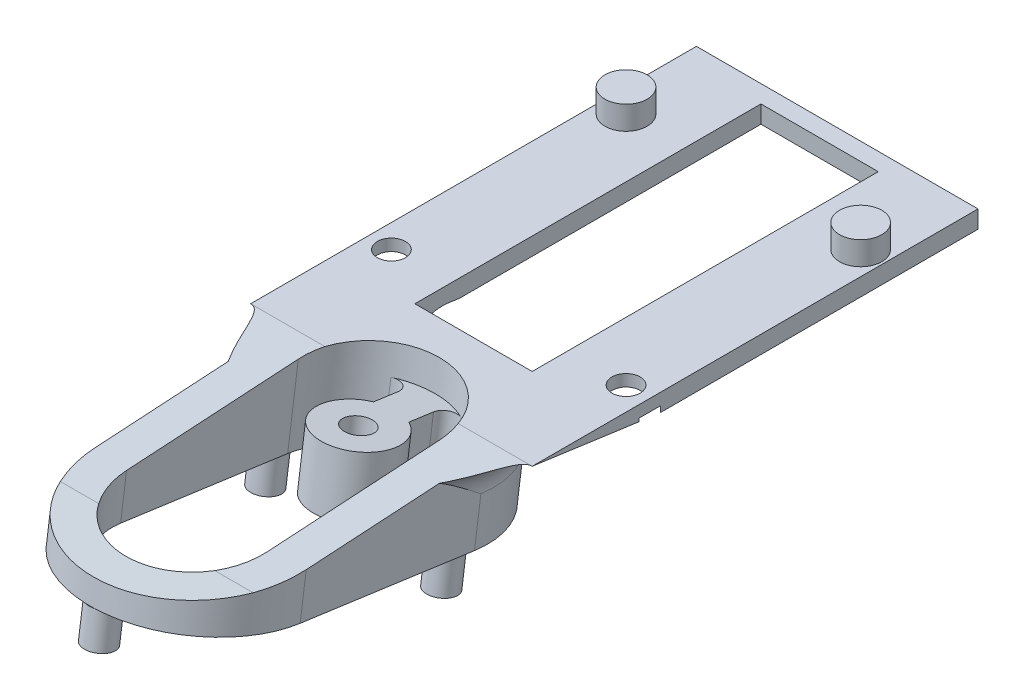
from build123d import *

# Parameters (mm, degrees)
ESQUISSE1_W               = 24
ESQUISSE1_H               = 38
ESQUISSE1_W_2             = 10.000000000000004
ESQUISSE1_H_2             = 29.499999999999996
SHAPE_DEPTH               = 1.5
ESQUISSE2_R               = 1.2000000000000004
VISHOLES_DEPTH            = 1.5
ESQUISSE3_R               = 1.7999999999999987
LOCKERS_DEPTH             = 2
ESQUISSE4_R               = 2.2
SCREWHATREMOVER_DEPTH     = 0.5
SUPPORT_REACH             = 24.743
SUPPORT_DIRECTION_2_REACH = 24.743
SHAPER_START              = -6.966462
ESQUISSE9_W               = 37.86778750077029
ESQUISSE9_H               = 40.82669381021731
SHAPER_ROUND_DEPTH        = 6.966462
HOLE_MIDDLE_DEPTH         = 48.39948931246374
ESQUISSE13_R              = 3.2
ESQUISSE13_R_2            = 1.2
VISFIXATION_DEPTH         = 5
CONG_1_R                  = 1
ESQUISSE15_R              = 1.2500000000000013
ESQUISSE15_R_2            = 1.2500000000000004
PLOTS_DEPTH               = 3
CONG_2_R                  = 3


with BuildPart() as part:
    # Esquisse1 → Shape (new body)
    with BuildSketch(Plane(origin=(0, 0, 0), x_dir=(1, 0, 0), z_dir=(0, 1, 0))):
        Rectangle(ESQUISSE1_W, ESQUISSE1_H)
        with Locations((2.22e-15, 2.7500000000000018)):
            Rectangle(ESQUISSE1_W_2, ESQUISSE1_H_2, mode=Mode.SUBTRACT)
    extrude(amount=SHAPE_DEPTH)

    # Esquisse2 → VisHoles (cut)
    with BuildSketch(Plane(origin=(0, 1.5, 0), x_dir=(1, 0, 0), z_dir=(0, 1, 0))):
        with Locations(Location((10.000000000000002, -8.999999999999993, 0), (0, 0, 270))):
            Circle(ESQUISSE2_R)
    visholes = extrude(amount=-VISHOLES_DEPTH, mode=Mode.SUBTRACT)

    # Esquisse3 → Lockers (add)
    with BuildSketch(Plane(origin=(0, 1.5, 0), x_dir=(1, 0, 0), z_dir=(0, 1, 0))):
        with Locations(Location((10.000000000000002, 11.000000000000007, 0), (0, 0, 90))):
            Circle(ESQUISSE3_R)
    lockers = extrude(amount=LOCKERS_DEPTH)

    # Esquisse4 → ScrewHatRemover (cut)
    with BuildSketch(Plane(origin=(0, 0, 0), x_dir=(1, 0, 0), z_dir=(0, 1, 0))):
        with Locations((10.000000000000002, -8.999999999999993)):
            Circle(ESQUISSE4_R)
    screwhatremover = extrude(amount=SCREWHATREMOVER_DEPTH, mode=Mode.SUBTRACT)

    # Symétrie1: VisHoles, Lockers, ScrewHatRemover across plane
    add(visholes.mirror(Plane(origin=(0, 0, 0), x_dir=(0, 0, 1), z_dir=(1, 0, 0))), mode=Mode.SUBTRACT)
    add(lockers.mirror(Plane(origin=(0, 0, 0), x_dir=(0, 0, 1), z_dir=(1, 0, 0))))
    add(screwhatremover.mirror(Plane(origin=(0, 0, 0), x_dir=(0, 0, 1), z_dir=(1, 0, 0))), mode=Mode.SUBTRACT)

    # Support: up to this face of the body (flat: up to its plane)
    support_end = Plane(part.part.faces().sort_by_distance((12, 0.75817099, -0.147077812))[0])
    # Esquisse8 → Support (add, up to the picked face)
    with BuildSketch(Plane(origin=(0, 0, 0), x_dir=(0, 0, -1), z_dir=(1, 0, 0)), mode=Mode.PRIVATE) as support_sk1:
        Polygon((-18.999999999999996, 1.5), (-38.99999999999999, 0.273241418675476), (-47.34732666365826, -0.08180614293195024), (-47.55367922057029, -1.5675445526985776), (-12.88644965934898, -6.3824375473126445), (-11.999999999999996, 0), (-11.999999999999996, 1.5), align=None)
    support_tool1 = split(extrude(support_sk1.sketch, amount=SUPPORT_REACH, mode=Mode.PRIVATE), bisect_by=support_end, keep=Keep.BOTH, mode=Mode.PRIVATE)
    add(support_tool1.solids().sort_by(Axis((0, -1.747723, 25.831509), (1, 0, 0)))[0])

    # Support direction 2: up to this face of the body (flat: up to its plane)
    support_direction_2_end = Plane(part.part.faces().sort_by_distance((-12, 0.75817099, -0.147077812))[0])
    # Esquisse8 → Support direction 2 (add, up to the picked face)
    with BuildSketch(Plane(origin=(0, 0, 0), x_dir=(0, 0, -1), z_dir=(1, 0, 0)), mode=Mode.PRIVATE) as support_direction_2_sk1:
        Polygon((-18.999999999999996, 1.5), (-38.99999999999999, 0.273241418675476), (-47.34732666365826, -0.08180614293195024), (-47.55367922057029, -1.5675445526985776), (-12.88644965934898, -6.3824375473126445), (-11.999999999999996, 0), (-11.999999999999996, 1.5), align=None)
    support_direction_2_tool1 = split(extrude(support_direction_2_sk1.sketch, amount=-SUPPORT_DIRECTION_2_REACH, mode=Mode.PRIVATE), bisect_by=support_direction_2_end, keep=Keep.BOTH, mode=Mode.PRIVATE)
    add(support_direction_2_tool1.solids().sort_by(Axis((0, -1.747723, 25.831509), (-1, 0, 0)))[0])

    # Esquisse9 → Shaper Round (cut)
    with BuildSketch(Plane(origin=(0, -8.017562452687358, 1.1135503406510208), x_dir=(1, 0, 0), z_dir=(0, -0.9904922731777516, 0.1375683712746876)).offset(SHAPER_START)):
        with Locations((3.55e-15, 27.4944104504371)):
            Rectangle(ESQUISSE9_W, ESQUISSE9_H)
        with BuildLine():
            Line((-8.999999999999998, 19.994410450437105), (-9.000000000000002, 34.994410450437094))
            ThreePointArc((-9.000000000000002, 34.994410450437094), (-2.38e-15, 43.99441045043709), (8.999999999999998, 34.99441045043711))
            Line((8.999999999999998, 34.99441045043711), (9.000000000000002, 19.9944104504371))
            ThreePointArc((9.000000000000002, 19.9944104504371), (4.37e-15, 10.994410450437105), (-8.999999999999998, 19.994410450437105))
        make_face(mode=Mode.SUBTRACT)
    extrude(amount=SHAPER_ROUND_DEPTH, mode=Mode.SUBTRACT)

    # Esquisse10 → Hole Middle (cut, through all, along a direction that is not the sketch's normal)
    with BuildSketch(Plane(origin=(0, 1.5, 0), x_dir=(1, 0, 0), z_dir=(0, 1, 0))):
        with BuildLine():
            Line((-5.999999999999987, -35.43483867777678), (-5.9999999999999885, -20.917859398553457))
            ThreePointArc((-5.9999999999999885, -20.917859398553457), (1.17e-15, -14.917859398553464), (5.999999999999996, -20.917859398553453))
            Line((5.999999999999996, -20.917859398553453), (6, -35.43483867777678))
            ThreePointArc((6, -35.43483867777678), (2.37e-15, -41.434838677776774), (-5.999999999999987, -35.43483867777678))
        make_face()
    extrude(amount=-HOLE_MIDDLE_DEPTH, dir=(0, 0.9904922731777516, -0.1375683712746876), mode=Mode.SUBTRACT)

    # Esquisse13 → VisFixation (add)
    # profile 1 of 3: a face of its own
    with BuildSketch(Plane(origin=(0, -8.017562452687361, 1.113550340651021), x_dir=(1, 0, 0), z_dir=(0, -0.9904922731777517, 0.13756837127468763))):
        with Locations((0, 21.597940400544502)):
            Circle(ESQUISSE13_R)
        with Locations(Location((0, 21.597940400544502, 0), (0, 0, 270))):
            Circle(ESQUISSE13_R_2, mode=Mode.SUBTRACT)
    # profile 2 of 3: a face of its own
    with BuildSketch(Plane(origin=(0, -8.017562452687361, 1.113550340651021), x_dir=(1, 0, 0), z_dir=(0, -0.9904922731777517, 0.13756837127468763))):
        with BuildLine():
            Line((0, 18.397940400544503), (0, 14.982377023575253))
            add(Edge.make_bspline(
                [(1.5000000000001044, 15.171090545997824), (1.3165092525639652, 15.124163886966414), (1.1313027330194316, 15.083796255686536), (0.9446588561097172, 15.050059603842444), (0.7568613118110248, 15.023012412419297), (0.5681991290207293, 15.002699172445709), (0.3789668557867015, 14.989149535001376), (0.1894648811528625, 14.982377024321183), (3.91e-14, 14.982377023575259)],
                knots=[0.4195697909851019, 0.4195697909851019, 0.4195697909851019, 0.4195697909851019, 0.4195697909851019, 0.4195697909851019, 0.4195697909851019, 0.4195697909851019, 0.4195697909851019, 0.49999870403978586, 0.49999870403978586, 0.49999870403978586, 0.49999870403978586, 0.49999870403978586, 0.49999870403978586, 0.49999870403978586, 0.49999870403978586, 0.49999870403978586], degree=8))
            Line((1.4999999999999996, 15.171090545997846), (1.4999999999999991, 18.771281595523988))
            ThreePointArc((1.4999999999999991, 18.771281595523988), (0.772881563997472, 18.49267807860891), (-5.9e-16, 18.397940400544503))
        make_face()
    # profile 3 of 3: a face of its own
    with BuildSketch(Plane(origin=(0, -8.017562452687361, 1.113550340651021), x_dir=(1, 0, 0), z_dir=(0, -0.9904922731777517, 0.13756837127468763))):
        with BuildLine():
            add(Edge.make_bspline(
                [(3.913e-14, 14.982377023575255), (-0.00266127699223137, 14.982377023564778), (-0.0053225466660317, 14.982378359757066), (-0.00798380817114017, 14.982381032139322), (-0.01064506065708574, 14.982385040698047), (-0.01330630327314769, 14.982390385419032), (-0.01596753516835533, 14.982397066287362), (-0.01862875549148768, 14.98240508328741), (-0.20809024321261407, 14.983070967063233), (-0.39490442545846705, 14.990311027604342), (-0.5814380400367319, 15.004138180929463), (-0.7674028136479139, 15.024538791186018), (-0.9525161219652903, 15.051483922349174), (-1.1365006719690984, 15.084930563413701), (-1.319084319955278, 15.12482244473297), (-1.500000000000116, 15.171090545888504)],
                knots=[0.49999870403978586, 0.49999870403978586, 0.49999870403978586, 0.49999870403978586, 0.49999870403978586, 0.49999870403978586, 0.49999870403978586, 0.49999870403978586, 0.49999870403978586, 0.5011284311666464, 0.5011284311666464, 0.5011284311666464, 0.5011284311666464, 0.5011284311666464, 0.5011284311666464, 0.5011284311666464, 0.580428264694274, 0.580428264694274, 0.580428264694274, 0.580428264694274, 0.580428264694274, 0.580428264694274, 0.580428264694274, 0.580428264694274, 0.580428264694274], degree=8))
            Line((0, 14.982377023575253), (0, 18.397940400544503))
            ThreePointArc((-5.9e-16, 18.397940400544503), (-0.7728815639974731, 18.49267807860891), (-1.5000000000000027, 18.771281595523988))
            Line((-1.5, 18.771281595523988), (-1.5, 15.171090545888532))
        make_face()
    extrude(amount=-VISFIXATION_DEPTH)

    # Congé1
    cong_1_edges = [part.edges().sort_by_distance(p)[0] for p in [
        (-1.500000000000058, -3.454269552884287, 15.796477373846919),
        (1.500000000000052, -3.454269552869248, 15.796477373955195),
    ]]
    fillet(cong_1_edges, radius=CONG_1_R)

    # Esquisse15 → Plots (add)
    with BuildSketch(Plane(origin=(0, -8.017562452687361, 1.113550340651021), x_dir=(1, 0, 0), z_dir=(0, -0.9904922731777517, 0.13756837127468763))):
        with Locations(Location((2.9e-16, 42.80161836794882, 0), (0, 0, 108.724380079))):
            Circle(ESQUISSE15_R)
        with Locations(Location((-7.497331899398751, 20.925330662597844, 0), (0, 0, 90))):
            Circle(ESQUISSE15_R_2)
        with Locations(Location((7.497331899398758, 20.925330662597844, 0), (0, 0, 90))):
            Circle(ESQUISSE15_R)
    extrude(amount=PLOTS_DEPTH)

    # Congé2
    # the kernel refuses this fillet: 3 mm, written as the material it adds along each edge
    with BuildSketch(Plane(origin=(1.78e-15, 1.6332628099632935, 19.959494567666457), x_dir=(0.35822590851954383, -0.12843863786029408, -0.9247581925941178), z_dir=(0.9336349385414768, 0.04928055478342888, 0.35481999444068824))) as cong_2_piece_1_section:
        with BuildLine():
            CenterArc((9.000000000000002 + CONG_2_R, -CONG_2_R), CONG_2_R, 90.00000000000004, 89.99999999999994)
            Line((9.000000000000002 + CONG_2_R, 2.21e-15), (9.000000000000002, 1.8e-16))
            Line((9.000000000000002, 1.8e-16), (9, -CONG_2_R))
        make_face()
    cong_2_piece_1 = revolve(axis=Axis((1.78e-15, 1.6332628099632935, 19.959494567666457), (0, 0.9904922731777516, -0.1375683712746876)), revolution_arc=152.56654818733762, mode=Mode.PRIVATE)
    cong_2_piece_1 = split(cong_2_piece_1, bisect_by=Plane(origin=(-5.829288306162035, 1.9606399234111627, 11.490129183953822), z_dir=(0, -0.9981241208460079, -0.06122286652374182)), keep=Keep.TOP, mode=Mode.PRIVATE)
    cong_2_piece_1 = split(cong_2_piece_1, bisect_by=Plane(origin=(-4.999999999999999, 0.20726603270333405, 11.382580860619012), z_dir=(-1, 0, 0)), keep=Keep.TOP, mode=Mode.PRIVATE)
    add(cong_2_piece_1)
    with BuildSketch(Plane(origin=(1.78e-15, 1.6332628099632935, 19.959494567666457), x_dir=(0.35822590851954383, -0.12843863786029408, -0.9247581925941178), z_dir=(0.9336349385414768, 0.04928055478342888, 0.35481999444068824))) as cong_2_piece_2_section:
        with BuildLine():
            CenterArc((9.000000000000002 + CONG_2_R, -CONG_2_R), CONG_2_R, 90.00000000000004, 89.99999999999994)
            Line((9.000000000000002 + CONG_2_R, 2.21e-15), (9.000000000000002, 1.8e-16))
            Line((9.000000000000002, 1.8e-16), (9, -CONG_2_R))
        make_face()
    cong_2_piece_2 = revolve(axis=Axis((1.78e-15, 1.6332628099632935, 19.959494567666457), (0, 0.9904922731777516, -0.1375683712746876)), revolution_arc=152.56654818733762, mode=Mode.PRIVATE)
    cong_2_piece_2 = split(cong_2_piece_2, bisect_by=Plane(origin=(-4.627043748081395, -0.571498521512579, 12.079374794654521), z_dir=(0, 0.13756837127468846, 0.9904922731777515)), keep=Keep.TOP, mode=Mode.PRIVATE)
    cong_2_piece_2 = split(cong_2_piece_2, bisect_by=Plane(origin=(-4.627043748081395, -0.5411007570483871, 11.999999999999995), z_dir=(0, 0, 1)), keep=Keep.TOP, mode=Mode.PRIVATE)
    cong_2_piece_2 = split(cong_2_piece_2, bisect_by=Plane(origin=(-4.999999999999999, -0.5411007570483871, 12.298238698796709), z_dir=(1, 0, 0)), keep=Keep.TOP, mode=Mode.PRIVATE)
    add(cong_2_piece_2)
    with BuildSketch(Plane(origin=(1.78e-15, 1.6332628099632935, 19.959494567666457), x_dir=(0.7480846392007623, 0.09129082855548622, 0.6572939655995013), z_dir=(-0.6636033247293638, 0.10291278539046118, 0.7409720548113211))) as cong_2_piece_3_section:
        with BuildLine():
            CenterArc((9.000000000000002 + CONG_2_R, -CONG_2_R), CONG_2_R, 89.99999999999997, 90)
            Line((9.000000000000002 + CONG_2_R, 1.9e-16), (9.000000000000002, 1e-17))
            Line((9.000000000000002, 1e-17), (9.000000000000002, -CONG_2_R))
        make_face()
    cong_2_piece_3 = revolve(axis=Axis((1.78e-15, 1.6332628099632935, 19.959494567666457), (0, 0.9904922731777516, -0.1375683712746876)), revolution_arc=152.56654818733753, mode=Mode.PRIVATE)
    cong_2_piece_3 = split(cong_2_piece_3, bisect_by=Plane(origin=(9.552749313011303, 1.5079185715822936, 18.870902527965296), z_dir=(0, -0.9981241208460079, -0.06122286652374182)), keep=Keep.TOP, mode=Mode.PRIVATE)
    cong_2_piece_3 = split(cong_2_piece_3, bisect_by=Plane(origin=(5.0000000000000036, 0.8435077548904713, 18.83014894442022), z_dir=(1, 0, 0)), keep=Keep.TOP, mode=Mode.PRIVATE)
    add(cong_2_piece_3)
    with BuildSketch(Plane(origin=(1.78e-15, 1.6332628099632935, 19.959494567666457), x_dir=(0.7480846392007623, 0.09129082855548622, 0.6572939655995013), z_dir=(-0.6636033247293638, 0.10291278539046118, 0.7409720548113211))) as cong_2_piece_4_section:
        with BuildLine():
            CenterArc((9.000000000000002 + CONG_2_R, -CONG_2_R), CONG_2_R, 89.99999999999997, 90)
            Line((9.000000000000002 + CONG_2_R, 1.9e-16), (9.000000000000002, 1e-17))
            Line((9.000000000000002, 1e-17), (9.000000000000002, -CONG_2_R))
        make_face()
    cong_2_piece_4 = revolve(axis=Axis((1.78e-15, 1.6332628099632935, 19.959494567666457), (0, 0.9904922731777516, -0.1375683712746876)), revolution_arc=152.56654818733753, mode=Mode.PRIVATE)
    cong_2_piece_4 = split(cong_2_piece_4, bisect_by=Plane(origin=(4.627043710647522, -0.5714984443225815, 12.07937478393369), z_dir=(0, 0.13756837127468846, 0.9904922731777515)), keep=Keep.TOP, mode=Mode.PRIVATE)
    cong_2_piece_4 = split(cong_2_piece_4, bisect_by=Plane(origin=(4.627043710647521, -0.5411006786783885, 11.999999999999995), z_dir=(0, 0, 1)), keep=Keep.TOP, mode=Mode.PRIVATE)
    cong_2_piece_4 = split(cong_2_piece_4, bisect_by=Plane(origin=(5.0000000000000036, -0.5411006786783885, 12.298238696571879), z_dir=(-1, 0, 0)), keep=Keep.TOP, mode=Mode.PRIVATE)
    add(cong_2_piece_4)


solid = part.part
